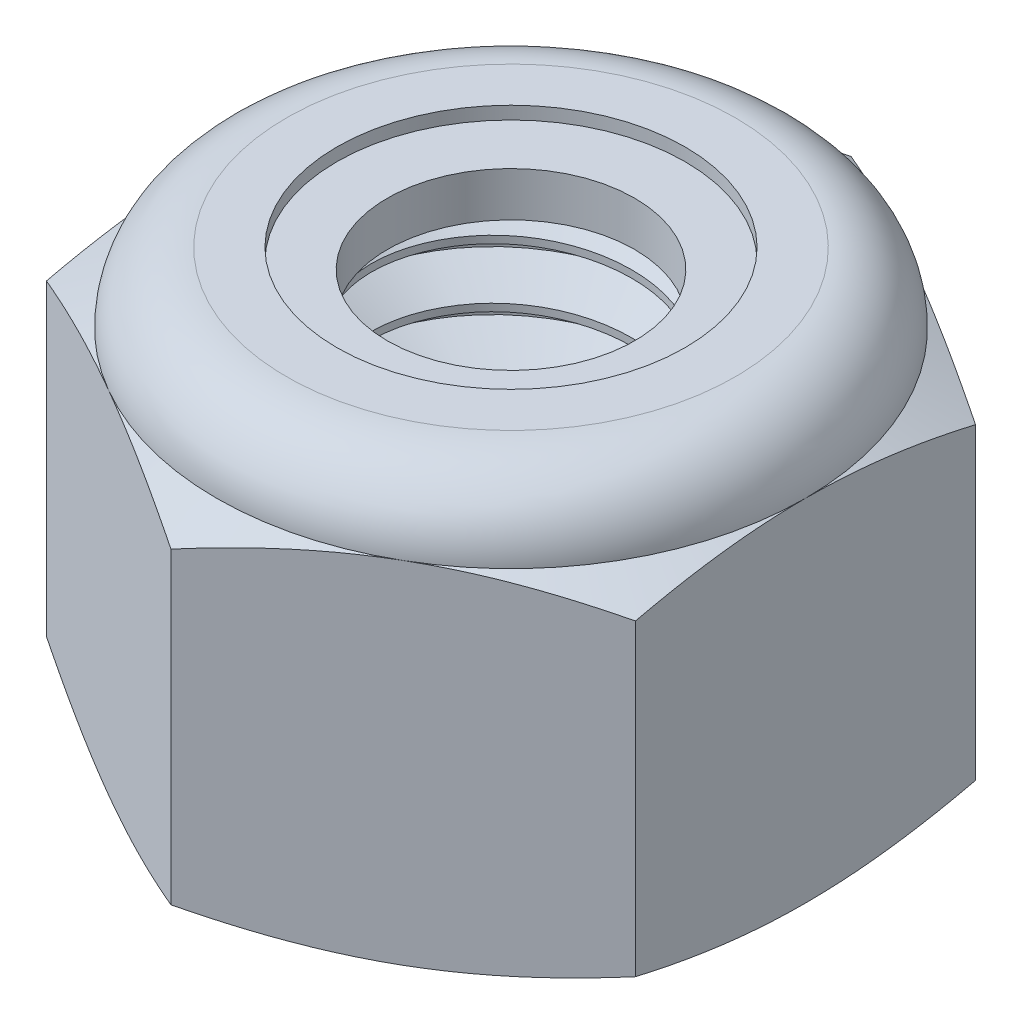
from build123d import *

# Parameters (mm, degrees)
EXTRUDE1_DEPTH   = 5
SKETCH2_W        = 2
SKETCH2_H        = 5
CUT_SWEEP1_PITCH = 0.7


with BuildPart() as part:
    # Sketch1 → Extrude1 (new body)
    with BuildSketch(Plane(origin=(0, 0, 0), x_dir=(1, 0, 0), z_dir=(0, 1, 0))):
        Polygon((0, 4.041451884), (-3.5, 2.020725942), (-3.5, -2.020725942), (0, -4.041451884), (3.5, -2.020725942), (3.5, 2.020725942), align=None)
    extrude(amount=EXTRUDE1_DEPTH)


with BuildPart() as body_2:
    # Sketch2 → Revolve1 (revolve)
    with BuildSketch(Plane(origin=(0, 0, 0), x_dir=(0, 0, -1), z_dir=(1, 0, 0))):
        with Locations((1, 2.5)):
            Rectangle(SKETCH2_W, SKETCH2_H)
    revolve(axis=Axis((0, -2, 0), (0, 1, 0)))

    # Boss-Extrude1 cone 1 section (through the dimple's axis) → Boss-Extrude1 (revolve)
    with BuildSketch(Plane(origin=(0, 0, 0), x_dir=(0, 0, -1), z_dir=(1, 0, 0))):
        Polygon((0, 0), (2, 0), (0, 2), align=None)
    revolve(axis=Axis((0, 0, 0), (0, 1, 0)))

    # Boss-Extrude2 cone 1 section (through the dimple's axis) → Boss-Extrude2 (revolve)
    with BuildSketch(Plane(origin=(0, 5, 0), x_dir=(0, 0, 1), z_dir=(1, 0, 0))):
        Polygon((0, 0), (2, 0), (0, 2), align=None)
    revolve(axis=Axis((0, 5, 0), (0, -1, 0)))

    # Cut-Sweep1: the profile of Sketch9 profile screwed along a right-hand helix of 8.142857 turns, 6 arcs to a turn; built about Z, then put on its axis
    cut_sweep1_z = Axis((0, 0, 0), (0, 0, 1))
    cut_sweep1_corners = [(2.0003, 0, -0.612673205), (2.0003, 0, 0.000173205), (1.545336663, 0, -0.2625), (1.545336663, 0, -0.35)]
    with BuildLine(mode=Mode.PRIVATE) as cut_sweep1_profile:
        Line(cut_sweep1_corners[0], cut_sweep1_corners[1])
        Line(cut_sweep1_corners[1], cut_sweep1_corners[2])
        Line(cut_sweep1_corners[2], cut_sweep1_corners[3])
        Line(cut_sweep1_corners[3], cut_sweep1_corners[0])
    cut_sweep1_cap = Face(cut_sweep1_profile.wire())
    cut_sweep1_turn_angles = [0, 30, 60, 90, 120, 150, 180, 210, 240, 270, 300, 330, 360]
    cut_sweep1_turn_weights = [1, 0.8660254037844387, 1, 0.8660254037844387, 1, 0.8660254037844387, 1, 0.8660254037844387, 1, 0.8660254037844387, 1, 0.8660254037844387, 1]
    cut_sweep1_turn_rails = [Edge.make_bspline([Vector(p[0], p[1], 0).rotate(cut_sweep1_z, cut_sweep1_turn_angles[k]) / cut_sweep1_turn_weights[k] + Vector(0, 0, p[2] + CUT_SWEEP1_PITCH * cut_sweep1_turn_angles[k] / 360) for k in range(13)], [0, 0, 0, 1, 1, 2, 2, 3, 3, 4, 4, 5, 5, 6, 6, 6], 2, cut_sweep1_turn_weights) for p in cut_sweep1_corners]
    cut_sweep1_turn_sides = [Face.make_surface_from_curves(cut_sweep1_turn_rails[p[0]], cut_sweep1_turn_rails[p[1]]) for p in [(0, 1), (1, 2), (2, 3), (3, 0)]]
    cut_sweep1_last_angles = [2880, 2905.714285714, 2931.428571429]
    cut_sweep1_last_weights = [1, 0.9009688679023498, 1]
    cut_sweep1_last_rails = [Edge.make_bspline([Vector(p[0], p[1], 0).rotate(cut_sweep1_z, cut_sweep1_last_angles[k]) / cut_sweep1_last_weights[k] + Vector(0, 0, p[2] + CUT_SWEEP1_PITCH * cut_sweep1_last_angles[k] / 360) for k in range(3)], [0, 0, 0, 1, 1, 1], 2, cut_sweep1_last_weights) for p in cut_sweep1_corners]
    cut_sweep1_last_sides = [Face.make_surface_from_curves(cut_sweep1_last_rails[p[0]], cut_sweep1_last_rails[p[1]]) for p in [(0, 1), (1, 2), (2, 3), (3, 0)]]
    cut_sweep1 = Plane(origin=(0, 0, 0), x_dir=(0, 0, -1), z_dir=(0, 1, 0)) * Solid(Shell([*[p.moved(Location((0, 0, CUT_SWEEP1_PITCH * i))) for i in range(8) for p in cut_sweep1_turn_sides], *cut_sweep1_last_sides, cut_sweep1_cap, cut_sweep1_cap.rotate(cut_sweep1_z, 2931.428571429).moved(Location((0, 0, CUT_SWEEP1_PITCH * 2931.428571429 / 360)))]))
    add(cut_sweep1, mode=Mode.SUBTRACT)


with BuildPart() as part_1:
    add(part.part)

    # Combine1: cut body 2
    add(body_2.part, mode=Mode.SUBTRACT)

    # Sketch5 → Cut-Revolve3 (revolve, cut)
    with BuildSketch(Plane(origin=(0, 0, 0), x_dir=(0, 0, -1), z_dir=(1, 0, 0))):
        with BuildLine():
            Line((0, 0), (3.5, 0))
            Line((3.5, 0), (4.041451884, 0.25248316))
            Line((4.041451884, 0.25248316), (4.041451884, 3.914183506))
            Line((4.041451884, 3.914183506), (3.5, 4.166666667))
            ThreePointArc((3.5, 4.166666667), (3.255922318, 4.755922318), (2.666666667, 5))
            Line((2.666666667, 5), (2.666666667, 6.27))
            Line((2.666666667, 6.27), (5.311451884, 6.27))
            Line((5.311451884, 6.27), (5.311451884, -1.27))
            Line((5.311451884, -1.27), (0, -1.27))
            Line((0, -1.27), (0, 0))
        make_face()
    revolve(axis=Axis((0, 0, 0), (0, 1, 0)), mode=Mode.SUBTRACT)

    # Sketch6 → Cut-Revolve4 (revolve, cut)
    with BuildSketch(Plane(origin=(0, 0, 0), x_dir=(0, 0, -1), z_dir=(1, 0, 0)), mode=Mode.PRIVATE) as cut_revolve4_sk:
        with BuildLine():
            Line((0, 4.166666667), (3.3476, 4.166666667))
            ThreePointArc((3.3476, 4.166666667), (3.148159244, 4.648159244), (2.666666667, 4.8476))
            Line((2.666666667, 4.8476), (2.068113053, 4.8476))
            Line((2.068113053, 4.8476), (2.068113053, 6.27))
            Line((2.068113053, 6.27), (0, 6.27))
            Line((0, 6.27), (0, 4.166666667))
        make_face()
    revolve(cut_revolve4_sk.sketch.rotate(Axis((0, 6.27, 0), (0, -1, 0)), 180), axis=Axis((0, 6.27, 0), (0, -1, 0)), mode=Mode.SUBTRACT)


with BuildPart() as body_2_2:
    # Sketch7 → Revolve2 (revolve)
    with BuildSketch(Plane(origin=(0, 0, 0), x_dir=(0, 0, -1), z_dir=(1, 0, 0))):
        with BuildLine():
            Line((1.46955944, 4.242866667), (3.266579964, 4.242866667))
            ThreePointArc((3.266579964, 4.242866667), (3.066430175, 4.620419399), (2.666666667, 4.7714))
            Line((2.666666667, 4.7714), (1.46955944, 4.7714))
            Line((1.46955944, 4.7714), (1.46955944, 4.242866667))
        make_face()
    revolve(axis=Axis((0, 4.242866667, 0), (0, 1, 0)))


solid = Compound([part_1.part, body_2_2.part])
